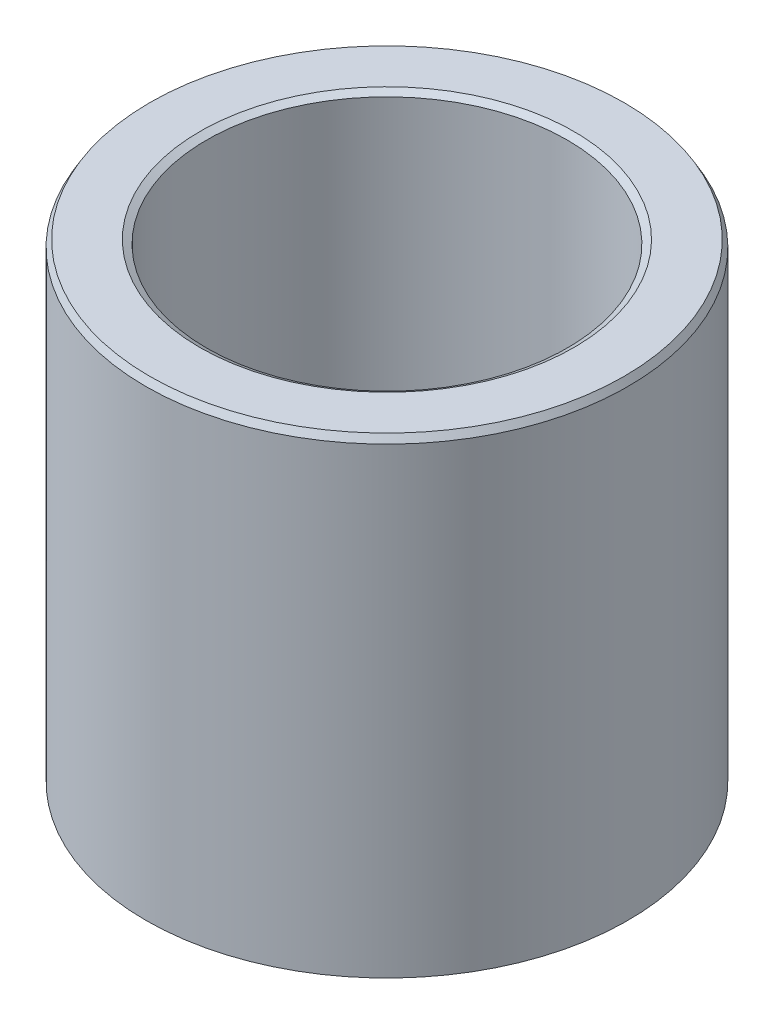
from build123d import *
from OCP.BRepFilletAPI import BRepFilletAPI_MakeChamfer

# Parameters (mm, degrees)
SKETCH1_R           = 52.5
BOSS_EXTRUDE1_DEPTH = 103.034649102
SKETCH2_R           = 39.26441666
CUT_EXTRUDE1_DEPTH  = 127.998578399
CHAMFER1_SIZE       = 1.48235463
CHAMFER1_SIZE2      = 0.855837845


with BuildPart() as part:
    # Sketch1 → Boss-Extrude1 (new body)
    with BuildSketch(Plane(origin=(0, 0, 0), x_dir=(1, 0, 0), z_dir=(0, 1, 0))):
        Circle(SKETCH1_R)
    extrude(amount=BOSS_EXTRUDE1_DEPTH)

    # Sketch2 → Cut-Extrude1 (cut, through all)
    with BuildSketch(Plane(origin=(0, 0, 0), x_dir=(1, 0, 0), z_dir=(0, 1, 0))):
        Circle(SKETCH2_R)
    extrude(amount=CUT_EXTRUDE1_DEPTH, mode=Mode.SUBTRACT)

    # Chamfer1: one chamfer whose edges measure the first distance from different faces: ONE call of the kernel's chamfer builder (chamfer() names one face for all edges)
    chamfer1_edges_1 = [part.edges().sort_by_distance(p)[0] for p in [
        (-39.26441666, 103.034649102, 0),
    ]]
    chamfer1_side_1 = [part.faces().sort_by_distance(p)[0] for p in [
        (-51.01507576, 103.034649102, 0),
    ]]
    chamfer1_edges_2 = [part.edges().sort_by_distance(p)[0] for p in [
        (-39.26441666, 0, 0),
    ]]
    chamfer1_side_2 = [part.faces().sort_by_distance(p)[0] for p in [
        (-39.26441666, 51.517324551, 0),
    ]]
    chamfer1_edges_3 = [part.edges().sort_by_distance(p)[0] for p in [
        (-52.5, 0, 0),
    ]]
    chamfer1_side_3 = [part.faces().sort_by_distance(p)[0] for p in [
        (-51.01507576, 0, 0),
    ]]
    chamfer1_edges_4 = [part.edges().sort_by_distance(p)[0] for p in [
        (-52.5, 103.034649102, 0),
    ]]
    chamfer1_side_4 = [part.faces().sort_by_distance(p)[0] for p in [
        (-52.5, 51.517324551, 0),
    ]]
    chamfer1 = BRepFilletAPI_MakeChamfer(part.part.solid().wrapped)
    for e in chamfer1_edges_1:
        chamfer1.Add(CHAMFER1_SIZE, CHAMFER1_SIZE2, e.wrapped, chamfer1_side_1[0].wrapped)  # the first distance lies on this face
    for e in chamfer1_edges_2:
        chamfer1.Add(CHAMFER1_SIZE, CHAMFER1_SIZE2, e.wrapped, chamfer1_side_2[0].wrapped)  # the first distance lies on this face
    for e in chamfer1_edges_3:
        chamfer1.Add(CHAMFER1_SIZE, CHAMFER1_SIZE2, e.wrapped, chamfer1_side_3[0].wrapped)  # the first distance lies on this face
    for e in chamfer1_edges_4:
        chamfer1.Add(CHAMFER1_SIZE, CHAMFER1_SIZE2, e.wrapped, chamfer1_side_4[0].wrapped)  # the first distance lies on this face
    add(Compound.cast(chamfer1.Shape()), mode=Mode.REPLACE)


solid = part.part
